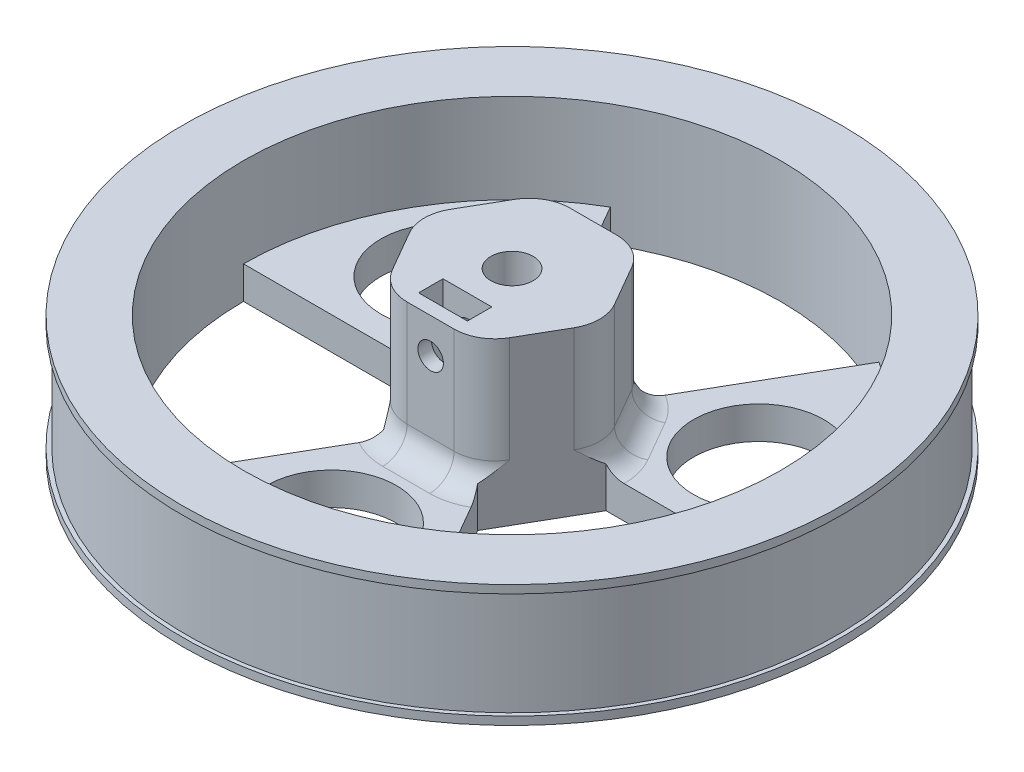
from build123d import *
from build123d.topology import SkipClean

# Parameters (mm, degrees)
SKETCH1_R                = 40.5
BOSS_EXTRUDE16_DEPTH     = 5
SKETCH1_23_R             = 5
BOSS_EXTRUDE17_DEPTH     = 5
CUT_EXTRUDE6_DEPTH       = 15
CUT_EXTRUDE7_DEPTH       = 5
CUT_EXTRUDE8_DEPTH       = 5
CUT_EXTRUDE9_DEPTH       = 5
BOSS_EXTRUDE19_DEPTH     = 5
CUT_EXTRUDE14_DEPTH      = 1
SKETCH24_R               = 8
CUT_EXTRUDE15_DEPTH      = 4
SKETCH24_2_R             = 8
CUT_EXTRUDE16_DEPTH      = 6
BOSS_EXTRUDE21_START     = -1
SKETCH30_R               = 40
SKETCH30_R_2             = 33
BOSS_EXTRUDE21_DEPTH     = 1
BOSS_EXTRUDE22_DEPTH     = 15
SKETCH33_R               = 2.6
CUT_EXTRUDE17_DEPTH      = 10
SKETCH35_W               = 6
SKETCH35_H               = 3
CUT_EXTRUDE18_DEPTH      = 10
CUT_EXTRUDE19_DEPTH      = 17
CUT_EXTRUDE19_DEPTH_BACK = 5
SKETCH36_R               = 1.569356798
SKETCH37_R               = 40.5
SKETCH37_R_2             = 33
BOSS_EXTRUDE23_DEPTH     = 10
SKETCH39_W               = 0.5
SKETCH39_H               = 13
BOSS_EXTRUDE25_DEPTH     = 5
FILLET2_R                = 5
FILLET3_R                = 3


with BuildPart() as part:
    # Sketch1 → Boss-Extrude16 (new body)
    with BuildSketch(Plane(origin=(0, 0, 0), x_dir=(1, 0, 0), z_dir=(0, 1, 0))):
        with Locations(Location((0, 0, 0), (0, 0, 270))):
            Circle(SKETCH1_R)
    extrude(amount=BOSS_EXTRUDE16_DEPTH)

    # Sketch1<23> → Boss-Extrude17 (add)
    with BuildSketch(Plane(origin=(0, 0, 0), x_dir=(1, 0, 0), z_dir=(0, 1, 0))):
        Circle(SKETCH1_23_R)
    extrude(amount=BOSS_EXTRUDE17_DEPTH)

    # Sketch1<29> → Cut-Extrude6 (cut)
    with BuildSketch(Plane(origin=(0, 0, 0), x_dir=(1, 0, 0), z_dir=(0, 1, 0))):
        with BuildLine():
            ThreePointArc((1.209994132, 1.5924554), (0.148641183, -1.994468801), (-1.43267703, 1.395505833))
            Line((-1.43267703, 1.395505833), (1.209994132, 1.5924554))
        make_face()
    extrude(amount=CUT_EXTRUDE6_DEPTH, mode=Mode.SUBTRACT)

    # Sketch13 → Cut-Extrude7 (cut)
    with BuildSketch(Plane(origin=(0, 5, 0), x_dir=(1, 0, 0), z_dir=(0, 1, 0))):
        with BuildLine():
            Line((-16.5, 28.578838325), (-3.827980833, 6.630257293))
            Line((-3.827980833, 6.630257293), (-3e-09, 6.630257293))
            Line((-3e-09, 6.630257293), (3.827980833, 6.630257293))
            Line((3.827980833, 6.630257293), (16.5, 28.578838325))
            ThreePointArc((16.5, 28.578838325), (8.541028451, 31.875552278), (-7.8e-08, 33))
            ThreePointArc((-7.8e-08, 33), (-8.541028526, 31.875552257), (-16.5, 28.578838325))
        make_face()
    extrude(amount=-CUT_EXTRUDE7_DEPTH, mode=Mode.SUBTRACT)

    # Sketch13<4> → Cut-Extrude8 (cut)
    with BuildSketch(Plane(origin=(0, 5, 0), x_dir=(1, 0, 0), z_dir=(0, 1, 0))):
        with BuildLine():
            Line((-5.741971189, -3.315128752), (-7.655961666, 0))
            Line((-7.655961666, 0), (-33, 0))
            ThreePointArc((-33, 0), (-31.875552302, -8.541028358), (-28.578838459, -16.499999767))
            ThreePointArc((-28.578838459, -16.499999767), (-23.334523874, -23.334523684), (-16.5, -28.578838325))
            Line((-16.5, -28.578838325), (-3.827980833, -6.630257293))
            Line((-3.827980833, -6.630257293), (-5.741971189, -3.315128752))
        make_face()
    extrude(amount=-CUT_EXTRUDE8_DEPTH, mode=Mode.SUBTRACT)

    # Sketch13<5> → Cut-Extrude9 (cut)
    with BuildSketch(Plane(origin=(0, 5, 0), x_dir=(1, 0, 0), z_dir=(0, 1, 0))):
        with BuildLine():
            Line((33, 0), (7.655961666, 0))
            Line((7.655961666, 0), (5.741971178, -3.31512877))
            Line((5.741971178, -3.31512877), (3.827980833, -6.630257293))
            Line((3.827980833, -6.630257293), (16.5, -28.578838325))
            ThreePointArc((16.5, -28.578838325), (23.334523686, -23.334523872), (28.578838193, -16.500000228))
            ThreePointArc((28.578838193, -16.500000228), (31.875552233, -8.541028616), (33, 0))
        make_face()
    extrude(amount=-CUT_EXTRUDE9_DEPTH, mode=Mode.SUBTRACT)

    # Sketch1<32> → Boss-Extrude19 (add)
    with BuildSketch(Plane(origin=(0, 0, 0), x_dir=(1, 0, 0), z_dir=(0, 1, 0))):
        with BuildLine():
            ThreePointArc((1.209994132, 1.5924554), (0.148641183, -1.994468801), (-1.43267703, 1.395505833))
            Line((-1.43267703, 1.395505833), (1.209994132, 1.5924554))
        make_face()
    extrude(amount=BOSS_EXTRUDE19_DEPTH)

    # Sketch13<11> → Cut-Extrude14 (cut)
    with BuildSketch(Plane(origin=(0, 5, 0), x_dir=(1, 0, 0), z_dir=(0, 1, 0))):
        with BuildLine():
            Line((-7.655961666, 0), (-3.827980833, 6.630257293))
            Line((-3.827980833, 6.630257293), (-16.5, 28.578838325))
            ThreePointArc((-16.5, 28.578838325), (-28.578838325, 16.5), (-33, 0))
            Line((-33, 0), (-7.655961666, 0))
        make_face()
        with BuildLine():
            Line((16.5, 28.578838325), (3.827980833, 6.630257293))
            Line((3.827980833, 6.630257293), (7.655961666, 0))
            Line((7.655961666, 0), (33, 0))
            ThreePointArc((33, 0), (28.578838325, 16.5), (16.5, 28.578838325))
        make_face()
        with BuildLine():
            Line((3.827980833, -6.630257293), (-3.827980833, -6.630257293))
            Line((-3.827980833, -6.630257293), (-16.5, -28.578838325))
            ThreePointArc((-16.5, -28.578838325), (0, -33), (16.5, -28.578838325))
            Line((16.5, -28.578838325), (3.827980833, -6.630257293))
        make_face()
    extrude(amount=-CUT_EXTRUDE14_DEPTH, mode=Mode.SUBTRACT)

    # Sketch24 → Cut-Extrude15 (cut)
    with BuildSketch(Plane(origin=(0, 5, 0), x_dir=(1, 0, 0), z_dir=(0, 1, 0))):
        with Locations(Location((0, -22.192555868, 0), (0, 0, 270))):
            Circle(SKETCH24_R)
        with Locations(Location((19.219317157, 11.096277934, 0), (0, 0, 270))):
            Circle(SKETCH24_R)
        with Locations(Location((-19.219317157, 11.096277934, 0), (0, 0, 270))):
            Circle(SKETCH24_R)
    extrude(amount=-CUT_EXTRUDE15_DEPTH, mode=Mode.SUBTRACT)

    # Sketch24<2> → Cut-Extrude16 (cut)
    with BuildSketch(Plane(origin=(0, 5, 0), x_dir=(1, 0, 0), z_dir=(0, 1, 0))):
        with Locations(Location((0, -22.192555868, 0), (0, 0, 270))):
            Circle(SKETCH24_2_R)
        with Locations(Location((19.219317157, 11.096277934, 0), (0, 0, 270))):
            Circle(SKETCH24_2_R)
        with Locations(Location((-19.219317157, 11.096277934, 0), (0, 0, 270))):
            Circle(SKETCH24_2_R)
    extrude(amount=-CUT_EXTRUDE16_DEPTH, mode=Mode.SUBTRACT)

    # Sketch30 → Boss-Extrude21 (add)
    with BuildSketch(Plane.XZ.offset(BOSS_EXTRUDE21_START)):
        Circle(SKETCH30_R)
        with Locations(Location((0, 0, 0), (0, 0, 90))):
            Circle(SKETCH30_R_2, mode=Mode.SUBTRACT)
    extrude(amount=BOSS_EXTRUDE21_DEPTH)

    # Sketch31 → Boss-Extrude22 (add)
    with BuildSketch(Plane(origin=(0, 5, 0), x_dir=(1, 0, 0), z_dir=(0, 1, 0))):
        Polygon((11.547005384, 0), (5.773502692, 10), (-5.773502692, 10), (-11.547005384, 0), (-5.773502692, -10), (5.773502692, -10), align=None)
    extrude(amount=BOSS_EXTRUDE22_DEPTH)

    # Sketch33 → Cut-Extrude17 (cut)
    with BuildSketch(Plane(origin=(0, 20, 0), x_dir=(1, 0, 0), z_dir=(0, 1, 0))):
        with Locations(Location((0, 0, 0), (0, 0, 270))):
            Circle(SKETCH33_R)
    extrude(amount=-CUT_EXTRUDE17_DEPTH, mode=Mode.SUBTRACT)

    # Sketch35 → Cut-Extrude18 (cut)
    with BuildSketch(Plane(origin=(0, 20, 0), x_dir=(1, 0, 0), z_dir=(0, 1, 0))):
        with Locations((-0.156352746, -6.826345259)):
            Rectangle(SKETCH35_W, SKETCH35_H)
    extrude(amount=-CUT_EXTRUDE18_DEPTH, mode=Mode.SUBTRACT)

    # Sketch36 → Cut-Extrude19 (cut, two sides: drawn at the far end of the back side and taken through both)
    with BuildSketch(Plane.XY.offset(5.326345259).offset(-CUT_EXTRUDE19_DEPTH_BACK)):
        with Locations(Location((0, 15.69600898, 0), (0, 0, 180))):
            Circle(SKETCH36_R)
    extrude(amount=CUT_EXTRUDE19_DEPTH + CUT_EXTRUDE19_DEPTH_BACK, mode=Mode.SUBTRACT)

    # Sketch37 → Boss-Extrude23 (add)
    with SkipClean():  # the faces are left unmerged after this step: merging them gives an invalid solid
        with BuildSketch(Plane(origin=(0, 5, 0), x_dir=(1, 0, 0), z_dir=(0, 1, 0))):
            with Locations(Location((0, 0, 0), (0, 0, 270))):
                Circle(SKETCH37_R)
            with Locations(Location((0, 0, 0), (0, 0, 270))):
                Circle(SKETCH37_R_2, mode=Mode.SUBTRACT)
        extrude(amount=BOSS_EXTRUDE23_DEPTH)
    add(part.part.scale(1), mode=Mode.REPLACE)  # the faces are merged on a copy

    # Sketch39 → Cut-Revolve1 (revolve, cut)
    with BuildSketch(Plane.XY, mode=Mode.PRIVATE) as cut_revolve1_sk:
        with Locations((40.25, 7.5)):
            Rectangle(SKETCH39_W, SKETCH39_H)
    revolve(cut_revolve1_sk.sketch.rotate(Axis((0, 0, 0), (0, 1, 0)), 90), axis=Axis((0, 0, 0), (0, 1, 0)), mode=Mode.SUBTRACT)

    # Sketch31<3> → Boss-Extrude25 (add)
    with BuildSketch(Plane(origin=(0, 5, 0), x_dir=(1, 0, 0), z_dir=(0, 1, 0))):
        Polygon((11.547005384, 0), (5.773502692, 10), (-5.773502692, 10), (-11.547005384, 0), (-5.773502692, -10), (5.773502692, -10), align=None)
    extrude(amount=-BOSS_EXTRUDE25_DEPTH)

    # Fillet2
    fillet2_edges = [part.edges().sort_by_distance(p)[0] for p in [
        (5.773502692, 12, 10),
        (11.547005384, 12, 0),
        (5.773502692, 12, -10),
        (-5.773502692, 12, -10),
        (-11.547005384, 12, 0),
        (-5.773502692, 12, 10),
    ]]
    fillet(fillet2_edges, radius=FILLET2_R)

    # Fillet3
    # the kernel refuses this fillet: 3 mm, written as the material it adds along each edge
    with BuildSketch(Plane(origin=(2.886751346, 4, 5), x_dir=(0, 0, 1), z_dir=(-1, 0, 0))) as fillet3_piece_1_section:
        with BuildLine():
            CenterArc((5 + FILLET3_R, FILLET3_R), FILLET3_R, 180, 90)
            Line((5 + FILLET3_R, 0), (5, 0))
            Line((5, 0), (5, FILLET3_R))
        make_face()
    fillet3_piece_1 = revolve(axis=Axis((2.886751346, 4, 5), (0, 1, 0)), revolution_arc=145.959010994, mode=Mode.PRIVATE)
    fillet3_piece_1 = split(fillet3_piece_1, bisect_by=Plane(origin=(5.63089288, 5.027584856, 10.247007441), z_dir=(-0.8660254037844389, 0, -0.4999999999999996)), keep=Keep.TOP, mode=Mode.PRIVATE)
    add(fillet3_piece_1)
    with BuildSketch(Plane(origin=(2.886751346, 4, 5), x_dir=(0, 0, 1), z_dir=(-1, 0, 0))) as fillet3_piece_2_section:
        with BuildLine():
            CenterArc((5 + FILLET3_R, FILLET3_R), FILLET3_R, 180, 90)
            Line((5 + FILLET3_R, 0), (5, 0))
            Line((5, 0), (5, FILLET3_R))
        make_face()
    fillet3_piece_2 = revolve(axis=Axis((2.886751346, 4, 5), (0, 1, 0)), revolution_arc=145.959010994, mode=Mode.PRIVATE)
    fillet3_piece_2 = split(fillet3_piece_2, bisect_by=Plane(origin=(6.175606905, 4.190788344, 10.696464926), z_dir=(-0.8660254037844383, 0, 0.5000000000000007)), keep=Keep.TOP, mode=Mode.PRIVATE)
    add(fillet3_piece_2)
    with BuildSketch(Plane(origin=(-2.886751346, 4, 10), x_dir=(0, 1, 0), z_dir=(1, 0, 0)), Plane(origin=(-7.216878365, 4, -7.5), x_dir=(0, 1, 0), z_dir=(-0.49999999999999983, 0, 0.8660254037844388)), Plane(origin=(10.103629711, 4, -2.5), x_dir=(0, 1, 0), z_dir=(-0.5, 0, -0.8660254037844387))) as fillet3_piece_3:
        with BuildLine():
            CenterArc((FILLET3_R, FILLET3_R), FILLET3_R, 180, 90)
            Line((0, FILLET3_R), (0, 0))
            Line((0, 0), (FILLET3_R, 0))
        make_face()
    extrude(amount=5.773502692)
    with BuildSketch(Plane(origin=(-2.886751346, 4, 5), x_dir=(0, 0, 1), z_dir=(1, 0, 0))) as fillet3_piece_4_section:
        with BuildLine():
            CenterArc((5 + FILLET3_R, -FILLET3_R), FILLET3_R, 90, 90)
            Line((5 + FILLET3_R, 0), (5, 0))
            Line((5, 0), (5, -FILLET3_R))
        make_face()
    fillet3_piece_4 = revolve(axis=Axis((-2.886751346, 4, 5), (0, -1, 0)), revolution_arc=145.959010994, mode=Mode.PRIVATE)
    fillet3_piece_4 = split(fillet3_piece_4, bisect_by=Plane(origin=(-5.630892878, 5.02758487, 10.247007444), z_dir=(0.8660254037844386, 0, -0.5000000000000001)), keep=Keep.TOP, mode=Mode.PRIVATE)
    add(fillet3_piece_4)
    with BuildSketch(Plane(origin=(-2.886751346, 4, 5), x_dir=(0, 0, 1), z_dir=(1, 0, 0))) as fillet3_piece_5_section:
        with BuildLine():
            CenterArc((5 + FILLET3_R, -FILLET3_R), FILLET3_R, 90, 90)
            Line((5 + FILLET3_R, 0), (5, 0))
            Line((5, 0), (5, -FILLET3_R))
        make_face()
    fillet3_piece_5 = revolve(axis=Axis((-2.886751346, 4, 5), (0, -1, 0)), revolution_arc=145.959010994, mode=Mode.PRIVATE)
    fillet3_piece_5 = split(fillet3_piece_5, bisect_by=Plane(origin=(-6.175606901, 4.19078831, 10.696464921), z_dir=(0.8660254037844387, 0, 0.49999999999999994)), keep=Keep.TOP, mode=Mode.PRIVATE)
    add(fillet3_piece_5)
    with BuildSketch(Plane(origin=(-5.773502692, 4, 0), x_dir=(-0.8660254037844387, 0, -0.49999999999999967), z_dir=(0.49999999999999967, 0, -0.8660254037844387))) as fillet3_piece_6_section:
        with BuildLine():
            CenterArc((5 + FILLET3_R, FILLET3_R), FILLET3_R, 180, 90)
            Line((5 + FILLET3_R, 0), (5, 0))
            Line((5, 0), (5, FILLET3_R))
        make_face()
    fillet3_piece_6 = revolve(axis=Axis((-5.773502692, 4, 0), (0, 1, 0)), revolution_arc=145.959010994, mode=Mode.PRIVATE)
    fillet3_piece_6 = split(fillet3_piece_6, bisect_by=Plane(origin=(-11.689615196, 5.027584856, -0.247007441), z_dir=(0.8660254037844386, 0, -0.5000000000000001)), keep=Keep.TOP, mode=Mode.PRIVATE)
    add(fillet3_piece_6)
    with BuildSketch(Plane(origin=(-5.773502692, 4, 0), x_dir=(-0.8660254037844387, 0, -0.49999999999999967), z_dir=(0.49999999999999967, 0, -0.8660254037844387))) as fillet3_piece_7_section:
        with BuildLine():
            CenterArc((5 + FILLET3_R, FILLET3_R), FILLET3_R, 180, 90)
            Line((5 + FILLET3_R, 0), (5, 0))
            Line((5, 0), (5, FILLET3_R))
        make_face()
    fillet3_piece_7 = revolve(axis=Axis((-5.773502692, 4, 0), (0, 1, 0)), revolution_arc=145.959010994, mode=Mode.PRIVATE)
    fillet3_piece_7 = split(fillet3_piece_7, bisect_by=Plane(origin=(-12.351213809, 4.190788344, 0), z_dir=(0, 0, -1)), keep=Keep.TOP, mode=Mode.PRIVATE)
    add(fillet3_piece_7)
    with BuildSketch(Plane(origin=(-2.886751346, 4, -5), x_dir=(-0.8660254037844389, 0, -0.49999999999999944), z_dir=(-0.49999999999999944, 0, 0.8660254037844389))) as fillet3_piece_8_section:
        with BuildLine():
            CenterArc((5 + FILLET3_R, -FILLET3_R), FILLET3_R, 90, 90)
            Line((5 + FILLET3_R, 0), (5, 0))
            Line((5, 0), (5, -FILLET3_R))
        make_face()
    fillet3_piece_8 = revolve(axis=Axis((-2.886751346, 4, -5), (0, -1, 0)), revolution_arc=145.959010994, mode=Mode.PRIVATE)
    fillet3_piece_8 = split(fillet3_piece_8, bisect_by=Plane(origin=(-6.05872232, 5.02758487, -10), z_dir=(0, 0, 1)), keep=Keep.TOP, mode=Mode.PRIVATE)
    add(fillet3_piece_8)
    with BuildSketch(Plane(origin=(-2.886751346, 4, -5), x_dir=(-0.8660254037844389, 0, -0.49999999999999944), z_dir=(-0.49999999999999944, 0, 0.8660254037844389))) as fillet3_piece_9_section:
        with BuildLine():
            CenterArc((5 + FILLET3_R, -FILLET3_R), FILLET3_R, 90, 90)
            Line((5 + FILLET3_R, 0), (5, 0))
            Line((5, 0), (5, -FILLET3_R))
        make_face()
    fillet3_piece_9 = revolve(axis=Axis((-2.886751346, 4, -5), (0, -1, 0)), revolution_arc=145.959010994, mode=Mode.PRIVATE)
    fillet3_piece_9 = split(fillet3_piece_9, bisect_by=Plane(origin=(-6.175606901, 4.19078831, -10.696464921), z_dir=(-0.8660254037844384, 0, 0.5000000000000006)), keep=Keep.TOP, mode=Mode.PRIVATE)
    add(fillet3_piece_9)
    with BuildSketch(Plane(origin=(5.773502692, 4, 0), x_dir=(0.8660254037844387, 0, -0.5), z_dir=(-0.5, 0, -0.8660254037844387))) as fillet3_piece_10_section:
        with BuildLine():
            CenterArc((5 + FILLET3_R, -FILLET3_R), FILLET3_R, 90, 90)
            Line((5 + FILLET3_R, 0), (5, 0))
            Line((5, 0), (5, -FILLET3_R))
        make_face()
    fillet3_piece_10 = revolve(axis=Axis((5.773502692, 4, 0), (0, -1, 0)), revolution_arc=145.959010994, mode=Mode.PRIVATE)
    fillet3_piece_10 = split(fillet3_piece_10, bisect_by=Plane(origin=(11.689615789, 5.027589468, -0.247008468), z_dir=(-0.8660254037844389, 0, -0.4999999999999996)), keep=Keep.TOP, mode=Mode.PRIVATE)
    add(fillet3_piece_10)
    with BuildSketch(Plane(origin=(5.773502692, 4, 0), x_dir=(0.8660254037844387, 0, -0.5), z_dir=(-0.5, 0, -0.8660254037844387))) as fillet3_piece_11_section:
        with BuildLine():
            CenterArc((5 + FILLET3_R, -FILLET3_R), FILLET3_R, 90, 90)
            Line((5 + FILLET3_R, 0), (5, 0))
            Line((5, 0), (5, -FILLET3_R))
        make_face()
    fillet3_piece_11 = revolve(axis=Axis((5.773502692, 4, 0), (0, -1, 0)), revolution_arc=145.959010994, mode=Mode.PRIVATE)
    fillet3_piece_11 = split(fillet3_piece_11, bisect_by=Plane(origin=(12.351213805, 4.190788313, 0), z_dir=(0, 0, -1)), keep=Keep.TOP, mode=Mode.PRIVATE)
    add(fillet3_piece_11)
    with BuildSketch(Plane(origin=(2.886751346, 4, -5), x_dir=(0.8660254037844386, 0, -0.5000000000000002), z_dir=(0.5000000000000002, 0, 0.8660254037844386))) as fillet3_piece_12_section:
        with BuildLine():
            CenterArc((5 + FILLET3_R, FILLET3_R), FILLET3_R, 180, 90)
            Line((5 + FILLET3_R, 0), (5, 0))
            Line((5, 0), (5, FILLET3_R))
        make_face()
    fillet3_piece_12 = revolve(axis=Axis((2.886751346, 4, -5), (0, 1, 0)), revolution_arc=145.959010994, mode=Mode.PRIVATE)
    fillet3_piece_12 = split(fillet3_piece_12, bisect_by=Plane(origin=(6.058722307, 5.027584869, -10), z_dir=(0, 0, 1)), keep=Keep.TOP, mode=Mode.PRIVATE)
    add(fillet3_piece_12)
    with BuildSketch(Plane(origin=(2.886751346, 4, -5), x_dir=(0.8660254037844386, 0, -0.5000000000000002), z_dir=(0.5000000000000002, 0, 0.8660254037844386))) as fillet3_piece_13_section:
        with BuildLine():
            CenterArc((5 + FILLET3_R, FILLET3_R), FILLET3_R, 180, 90)
            Line((5 + FILLET3_R, 0), (5, 0))
            Line((5, 0), (5, FILLET3_R))
        make_face()
    fillet3_piece_13 = revolve(axis=Axis((2.886751346, 4, -5), (0, 1, 0)), revolution_arc=145.959010994, mode=Mode.PRIVATE)
    fillet3_piece_13 = split(fillet3_piece_13, bisect_by=Plane(origin=(6.175606895, 4.190788352, -10.69646491), z_dir=(0.8660254037844387, 0, 0.49999999999999994)), keep=Keep.TOP, mode=Mode.PRIVATE)
    add(fillet3_piece_13)


solid = part.part
